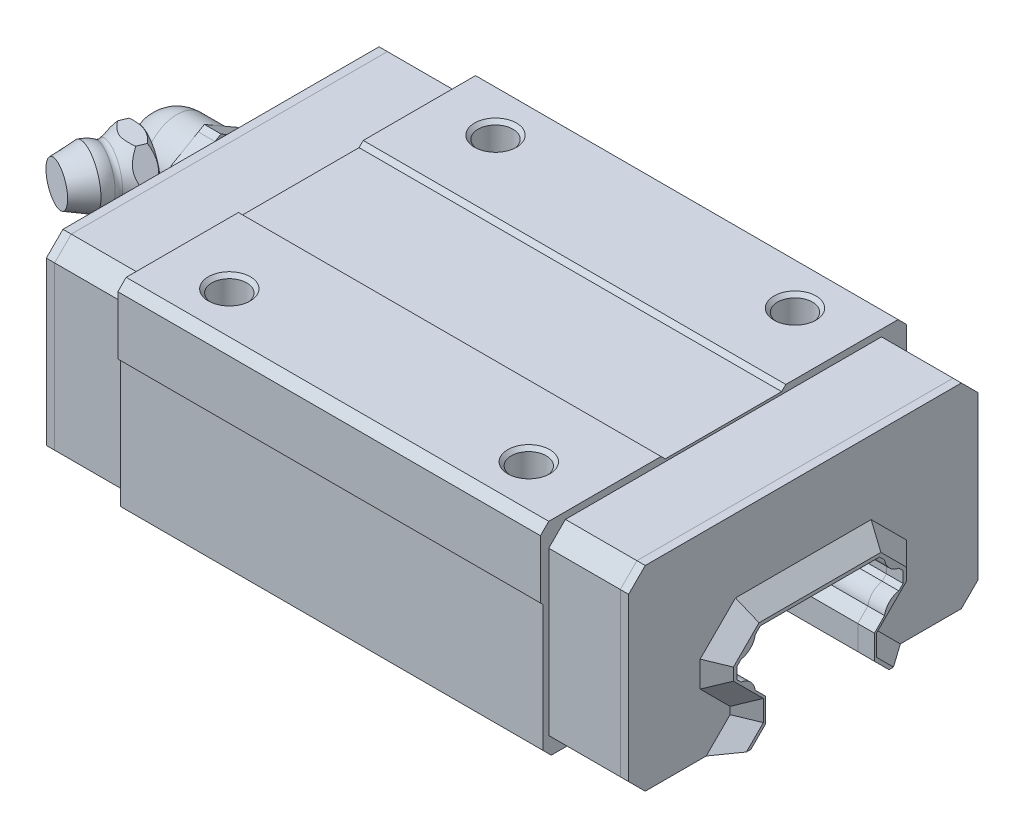
from build123d import *

# Parameters (mm, degrees)
BOSS_EXTRUDE1_START            = -69.999299
BOSS_EXTRUDE1_DEPTH            = 67.999756
BOSS_EXTRUDE4_START            = -78.599153
BOSS_EXTRUDE4_DEPTH            = 50.800048
BOSS_EXTRUDE5_DEPTH            = 1
BOSS_EXTRUDE6_DEPTH            = 1
M5X0_8_TAPPED_HOLE1_AT_2_COUNT = 2
M5X0_8_TAPPED_HOLE1_AT_2_PITCH = 48.16601337
M5X0_8_TAPPED_HOLE1_AT_3_COUNT = 2
M5X0_8_TAPPED_HOLE1_AT_3_PITCH = 32
M5X0_8_TAPPED_HOLE1_AT_4_COUNT = 2
M5X0_8_TAPPED_HOLE1_AT_4_PITCH = 35.999511719
CUT_EXTRUDE2_START             = -51.889852
SKETCH17_W                     = 9.974639027
SKETCH17_H                     = 9.95812392
CUT_EXTRUDE2_DEPTH             = 65.208591
BOSS_EXTRUDE7_DEPTH            = 1.999985
BOSS_EXTRUDE11_DEPTH           = 69.999755859
BOSS_EXTRUDE14_DEPTH           = 2
CHAMFER1_SIZE                  = 2
BOSS_EXTRUDE15_DEPTH           = 2
CHAMFER2_SIZE                  = 2


with BuildPart() as part:
    # Sketch8 → Boss-Extrude1 (new body)
    with BuildSketch(Plane.ZY.offset(-46.000945091).offset(BOSS_EXTRUDE1_START)):
        Polygon((-37.200896263, 28.981330872), (-37.200896263, 28.118293762), (-34.33245945, 25.249885559), (-30.000945091, 25.249656004), (-30.000945091, 25.249885559), (-27.000548363, 25.249566555), (-25.000540733, 27.249564648), (-25.000945091, 46.749885559), (-27.00083828, 48.749885559), (-45.275603294, 48.749885559), (-65.001051903, 48.749885559), (-67.000945091, 46.749992371), (-67.000494957, 27.249640942), (-65.000533104, 25.249685764), (-62.000945091, 25.249741775), (-61.132849693, 25.249705791), (-59.400938988, 25.249790324), (-57.668852297, 25.249822667), (-54.800749779, 28.118293762), (-54.800749779, 28.981330872), (-58.400847435, 32.581428528), (-58.400847435, 35.7032547), (-54.154265404, 39.949836731), (-37.847380638, 39.949836731), (-33.600509644, 35.702905655), (-33.600798607, 32.581428528), align=None)
    extrude(amount=-BOSS_EXTRUDE1_DEPTH)

    # Sketch9 → Boss-Extrude4 (add)
    with BuildSketch(Plane.ZY.offset(-46.000945091).offset(BOSS_EXTRUDE4_START)):
        Polygon((-67.700896263, 26.052594185), (-66.69870472, 25.050402641), (-62.000945091, 25.049934387), (-62.000945091, 25.249885559), (-62.000945091, 44.663492239), (-30.000945091, 44.663492239), (-30.000945091, 25.049934387), (-25.299723625, 25.049934387), (-24.300749779, 26.04890871), (-24.300749779, 41.249034882), (-24.000945091, 41.548839569), (-24.000945091, 48.550754557), (-25.000117299, 49.549934387), (-38.499411581, 49.549934387), (-38.999409674, 49.049934387), (-45.795134544, 49.049934387), (-46.20748806, 49.049934387), (-52.998428822, 49.049934387), (-53.498428345, 49.549934387), (-53.500700951, 49.549934387), (-67.000945091, 49.549934387), (-68.000945091, 48.549690247), (-68.000945091, 41.549934387), (-67.698792458, 41.250728607), align=None)
    extrude(amount=-BOSS_EXTRUDE4_DEPTH)

    # Sketch13 → M5x0.8 Tapped Hole1 (revolve, cut)
    with BuildSketch(Plane(origin=(132.000244141, 49.549934387, -30.000945091), x_dir=(0, 0, 1), z_dir=(1, 0, 0))):
        Polygon((0, 0), (0, 9.503075458), (2.1, 8.241268158), (2.1, 0.425), (2.525, 0), align=None)
    m5x0_8_tapped_hole1 = revolve(axis=Axis((132.000244141, 55.899934387, -30.000945091), (0, -1, 0)), mode=Mode.SUBTRACT)

    # M5x0.8 Tapped Hole1 at 2: M5x0.8 Tapped Hole1 ×2
    with Locations(*[Vector(0.7474048441996252, 0, -0.664368872590321) * (i * M5X0_8_TAPPED_HOLE1_AT_2_PITCH) for i in range(1, M5X0_8_TAPPED_HOLE1_AT_2_COUNT)]):
        add(m5x0_8_tapped_hole1, mode=Mode.SUBTRACT)

    # M5x0.8 Tapped Hole1 at 3: M5x0.8 Tapped Hole1 ×2
    with Locations(*[(0, 0, -i * M5X0_8_TAPPED_HOLE1_AT_3_PITCH) for i in range(1, M5X0_8_TAPPED_HOLE1_AT_3_COUNT)]):
        add(m5x0_8_tapped_hole1, mode=Mode.SUBTRACT)

    # M5x0.8 Tapped Hole1 at 4: M5x0.8 Tapped Hole1 ×2
    with Locations(*[(i * M5X0_8_TAPPED_HOLE1_AT_4_PITCH, 0, 0) for i in range(1, M5X0_8_TAPPED_HOLE1_AT_4_COUNT)]):
        add(m5x0_8_tapped_hole1, mode=Mode.SUBTRACT)


with BuildPart() as body_2:
    # Sketch11 → Boss-Extrude5 (new body)
    with BuildSketch(Plane(origin=(184, 0, 0), x_dir=(0, 0, -1), z_dir=(1, 0, 0))):
        Polygon((37.847380638, 39.949836731), (54.154265404, 39.949836731), (58.400847435, 35.7032547), (58.400847435, 32.581428528), (54.800749779, 28.981330872), (54.800749779, 28.118293762), (57.668852297, 25.249822667), (59.400938988, 25.249790324), (61.132849693, 25.249705791), (62.000945091, 25.249741775), (65.000533104, 25.249685764), (67.000494957, 27.249640942), (67.000945091, 46.749992371), (65.001051903, 48.749885559), (27.00083828, 48.749885559), (25.000945091, 46.749885559), (25.000540733, 27.249564648), (27.000548363, 25.249566555), (30.000945091, 25.249885559), (34.33245945, 25.249885559), (37.200896263, 28.118293762), (37.200896263, 28.981330872), (33.600798607, 32.581428528), (33.600509644, 35.702905655), align=None)
    extrude(amount=BOSS_EXTRUDE5_DEPTH)


with BuildPart() as body_3:
    # Sketch12 → Boss-Extrude6 (new body)
    with BuildSketch(Plane.ZY.offset(-116.000244141)):
        Polygon((-54.154265404, 39.949836731), (-37.847380638, 39.949836731), (-33.600509644, 35.702905655), (-33.600798607, 32.581428528), (-37.200896263, 28.981330872), (-37.200896263, 28.118293762), (-34.33245945, 25.249885559), (-30.000945091, 25.249656004), (-27.000548363, 25.249566555), (-25.000540733, 27.249564648), (-25.000945091, 46.749885559), (-27.00083828, 48.749885559), (-65.001051903, 48.749885559), (-67.000945091, 46.749992371), (-67.000494957, 27.249640942), (-65.000533104, 25.249685764), (-62.000945091, 25.249741775), (-61.132849693, 25.249705791), (-59.400938988, 25.249790324), (-57.668852297, 25.249822667), (-54.800749779, 28.118293762), (-54.800749779, 28.981330872), (-58.400847435, 32.581428528), (-58.400847435, 35.7032547), align=None)
    extrude(amount=BOSS_EXTRUDE6_DEPTH)

    # Sketch18 → Boss-Extrude7 (add)
    with BuildSketch(Plane.ZY.offset(-115.000244141)):
        Polygon((-46.726546205, 48.749885559), (-50.000945091, 46.85974884), (-50.000945091, 42.240533273), (-48.631224043, 41.449582905), (-46.033496656, 39.949836731), (-45.968542088, 39.949836731), (-42.000945091, 42.240119934), (-42.000587097, 46.859128776), (-45.27488782, 48.749885559), (-45.275568994, 48.749885559), align=None)
        Polygon((-46.000992693, 49.1687091), (-46.726546205, 48.749885559), (-45.275568994, 48.749885559), align=None)
    extrude(amount=BOSS_EXTRUDE7_DEPTH)



with BuildPart() as body_4:
    # Sketch16 → Revolve1 (revolve)
    with BuildSketch(Plane(origin=(0, 44.549934387, 0), x_dir=(-1, 0, 0), z_dir=(0, 1, 0)), mode=Mode.PRIVATE) as revolve1_sk:
        with BuildLine():
            Line((-105.617607117, -44.363028526), (-108.80043245, -43.044703315))
            Line((-108.80043245, -43.044703315), (-105.700494728, -35.560886301))
            Line((-105.700494728, -35.560886301), (-103.483024597, -36.479392052))
            Line((-103.483024597, -36.479392052), (-103.684791565, -39.318274498))
            ThreePointArc((-103.684791565, -39.318274498), (-104.045671043, -39.969854034), (-104.543486379, -40.523902571))
            ThreePointArc((-104.543486379, -40.523902571), (-104.748995386, -40.809827783), (-104.811833864, -41.156293516))
            ThreePointArc((-104.811833864, -41.156293516), (-104.693571108, -42.113365948), (-104.42350769, -43.039130211))
            Line((-104.42350769, -43.039130211), (-104.838172913, -44.040205956))
            Line((-104.838172913, -44.040205956), (-105.617607117, -44.363028526))
        make_face()
    revolve(revolve1_sk.sketch.rotate(Axis((105.001716614, 44.549934387, -33.873908043), (0.38268756468709164, 0, -0.9238778208366424)), 180), axis=Axis((105.001716614, 44.549934387, -33.873908043), (0.38268756468709164, 0, -0.9238778208366424)))

    # Sketch17 → Cut-Extrude2 (cut)
    with BuildSketch(Plane(origin=(30.924229963, 0, -74.656750899), x_dir=(0.9238778208366417, 0, 0.38268756468709325), z_dir=(-0.38268756468709325, 0, 0.9238778208366417)).offset(CUT_EXTRUDE2_START)):
        with Locations((84.045633753, 44.549934387)):
            Rectangle(SKETCH17_W, SKETCH17_H)
        Polygon((82.024828278, 48.050072143), (80.004022803, 44.549934387), (82.024828278, 41.049796631), (86.06643923, 41.049796631), (88.087244705, 44.549934387), (86.06643923, 48.050072143), align=None, mode=Mode.SUBTRACT)
    extrude(amount=CUT_EXTRUDE2_DEPTH, mode=Mode.SUBTRACT)


with BuildPart() as body_3_1:
    add(body_3.part)

    add(body_4.part)  # Revolve3 merges body 4
    # Sketch19 → Revolve3 (revolve)
    with BuildSketch(Plane(origin=(0, 44.549934387, 0), x_dir=(-1, 0, 0), z_dir=(0, 1, 0))):
        with BuildLine():
            Line((-109.7003479, -50.000945091), (-113.000259399, -50.000945091))
            Line((-113.000259399, -50.000945091), (-113.000259399, -46.000945091))
            Line((-113.000259399, -46.000945091), (-105.7003479, -46.000945091))
            ThreePointArc((-105.7003479, -46.000945091), (-106.871920776, -48.829372216), (-109.7003479, -50.000945091))
        make_face()
    revolve(axis=Axis((105.7003479, 44.549934387, -46.000945091), (1, 0, 0)))


with BuildPart() as body_4_2:
    # Sketch20 → Boss-Extrude11 (new body)
    with BuildSketch(Plane.ZY.offset(-115.000244141)):
        with BuildLine():
            Line((-56.000945091, 34.709846497), (-55.473011971, 35.236911774))
            ThreePointArc((-55.473011971, 35.236911774), (-54.345303642, 35.813840972), (-53.768374443, 36.941549301))
            Line((-53.768374443, 36.941549301), (-53.160857201, 37.549934387))
            Line((-53.160857201, 37.549934387), (-38.840519428, 37.549545288))
            Line((-38.840519428, 37.549545288), (-38.232676506, 36.941701889))
            ThreePointArc((-38.232676506, 36.941701889), (-37.655754627, 35.814040922), (-36.528093338, 35.237119675))
            Line((-36.528093338, 35.237119675), (-36.000945091, 34.709846497))
            Line((-36.000945091, 34.709846497), (-36.000945091, 33.379768372))
            Line((-36.000945091, 33.379768372), (-36.516084671, 32.863981247))
            ThreePointArc((-36.516084671, 32.863981247), (-37.65565644, 32.285168434), (-38.234468937, 31.145596504))
            Line((-38.234468937, 31.145596504), (-39.450896263, 29.9298172))
            Line((-39.450896263, 29.9298172), (-39.450896263, 26.999885559))
            Line((-39.450896263, 26.999885559), (-37.700857082, 25.249885559))
            Line((-37.700857082, 25.249885559), (-34.33245945, 25.249885559))
            Line((-34.33245945, 25.249885559), (-37.200896263, 28.118293762))
            Line((-37.200896263, 28.118293762), (-37.200896263, 28.981330872))
            Line((-37.200896263, 28.981330872), (-33.600798607, 32.581428528))
            Line((-33.600798607, 32.581428528), (-33.600509644, 35.702905655))
            Line((-33.600509644, 35.702905655), (-37.847380638, 39.949836731))
            Line((-37.847380638, 39.949836731), (-45.968542088, 39.949836731))
            Line((-45.968542088, 39.949836731), (-46.033496656, 39.949836731))
            Line((-46.033496656, 39.949836731), (-54.154265404, 39.949836731))
            Line((-54.154265404, 39.949836731), (-58.400847435, 35.7032547))
            Line((-58.400847435, 35.7032547), (-58.400847435, 32.581428528))
            Line((-58.400847435, 32.581428528), (-54.800749779, 28.981330872))
            Line((-54.800749779, 28.981330872), (-54.800749779, 28.118293762))
            Line((-54.800749779, 28.118293762), (-57.668852297, 25.249822667))
            Line((-57.668852297, 25.249822667), (-54.300749779, 25.249885559))
            Line((-54.300749779, 25.249885559), (-52.550749779, 26.999885559))
            Line((-52.550749779, 26.999885559), (-52.550749779, 29.9298172))
            Line((-52.550749779, 29.9298172), (-53.766649723, 31.145683289))
            ThreePointArc((-53.766649723, 31.145683289), (-54.345460672, 32.285243093), (-55.485020638, 32.864053726))
            Line((-55.485020638, 32.864053726), (-56.000945091, 33.379768372))
            Line((-56.000945091, 33.379768372), (-56.000945091, 34.709846497))
        make_face()
    extrude(amount=-BOSS_EXTRUDE11_DEPTH)


with BuildPart() as body_5:
    # Sketch21 → Boss-Extrude14 (new body)
    with BuildSketch(Plane.ZY.offset(-115.000244141)):
        with BuildLine():
            Line((-56.000945091, 34.709846497), (-55.473011971, 35.236911774))
            ThreePointArc((-55.473011971, 35.236911774), (-54.345303642, 35.813840972), (-53.768374443, 36.941549301))
            Line((-53.768374443, 36.941549301), (-53.160857201, 37.549934387))
            Line((-53.160857201, 37.549934387), (-38.840519428, 37.549545288))
            Line((-38.840519428, 37.549545288), (-38.232676506, 36.941701889))
            ThreePointArc((-38.232676506, 36.941701889), (-37.655754627, 35.814040922), (-36.528093338, 35.237119675))
            Line((-36.528093338, 35.237119675), (-36.000945091, 34.709846497))
            Line((-36.000945091, 34.709846497), (-36.000945091, 33.379768372))
            Line((-36.000945091, 33.379768372), (-36.516084671, 32.863981247))
            ThreePointArc((-36.516084671, 32.863981247), (-37.65565644, 32.285168434), (-38.234468937, 31.145596504))
            Line((-38.234468937, 31.145596504), (-39.450896263, 29.9298172))
            Line((-39.450896263, 29.9298172), (-39.450896263, 26.999885559))
            Line((-39.450896263, 26.999885559), (-37.700857082, 25.249885559))
            Line((-37.700857082, 25.249885559), (-34.33245945, 25.249885559))
            Line((-34.33245945, 25.249885559), (-37.200896263, 28.118293762))
            Line((-37.200896263, 28.118293762), (-37.200896263, 28.981330872))
            Line((-37.200896263, 28.981330872), (-33.600798607, 32.581428528))
            Line((-33.600798607, 32.581428528), (-33.600509644, 35.702905655))
            Line((-33.600509644, 35.702905655), (-37.847380638, 39.949836731))
            Line((-37.847380638, 39.949836731), (-54.154265404, 39.949836731))
            Line((-54.154265404, 39.949836731), (-58.400847435, 35.7032547))
            Line((-58.400847435, 35.7032547), (-58.400847435, 32.581428528))
            Line((-58.400847435, 32.581428528), (-54.800749779, 28.981330872))
            Line((-54.800749779, 28.981330872), (-54.800749779, 28.118293762))
            Line((-54.800749779, 28.118293762), (-57.668852297, 25.249822667))
            Line((-57.668852297, 25.249822667), (-54.300749779, 25.249885559))
            Line((-54.300749779, 25.249885559), (-52.550749779, 26.999885559))
            Line((-52.550749779, 26.999885559), (-52.550749779, 29.9298172))
            Line((-52.550749779, 29.9298172), (-53.766649723, 31.145683289))
            ThreePointArc((-53.766649723, 31.145683289), (-54.345460672, 32.285243093), (-55.485020638, 32.864053726))
            Line((-55.485020638, 32.864053726), (-56.000945091, 33.379768372))
            Line((-56.000945091, 33.379768372), (-56.000945091, 34.709846497))
        make_face()
    extrude(amount=BOSS_EXTRUDE14_DEPTH)

    # Chamfer1
    chamfer1_edges = [body_5.edges().sort_by_distance(p)[0] for p in [
        (113.000244141, 26.684089661, -35.766677856),
        (113.000244141, 28.549812317, -37.200896263),
        (113.000244141, 30.7813797, -35.400847435),
        (113.000244141, 34.142167091, -33.600654125),
        (113.000244141, 37.826371193, -35.723945141),
        (113.000244141, 39.949836731, -46.000823021),
        (113.000244141, 37.826545715, -56.277556419),
        (113.000244141, 34.142341614, -58.400847435),
        (113.000244141, 30.7813797, -56.600798607),
        (113.000244141, 28.549812317, -54.800749779),
        (113.000244141, 26.684058215, -56.234801038),
    ]]
    chamfer(chamfer1_edges, length=CHAMFER1_SIZE - 0.0001)  # a hair under: the kernel refuses the full size


with BuildPart() as body_6:
    # Sketch22 → Boss-Extrude15 (new body)
    with BuildSketch(Plane(origin=(185, 0, 0), x_dir=(0, 0, -1), z_dir=(1, 0, 0))):
        with BuildLine():
            Line((55.473011971, 35.236911774), (56.000945091, 34.709846497))
            Line((56.000945091, 34.709846497), (56.000945091, 33.379768372))
            Line((56.000945091, 33.379768372), (55.485020638, 32.864053726))
            ThreePointArc((55.485020638, 32.864053726), (54.345460672, 32.285243093), (53.766649723, 31.145683289))
            Line((53.766649723, 31.145683289), (52.550749779, 29.9298172))
            Line((52.550749779, 29.9298172), (52.550749779, 26.999885559))
            Line((52.550749779, 26.999885559), (54.300749779, 25.249885559))
            Line((54.300749779, 25.249885559), (57.668852297, 25.249822667))
            Line((57.668852297, 25.249822667), (54.800749779, 28.118293762))
            Line((54.800749779, 28.118293762), (54.800749779, 28.981330872))
            Line((54.800749779, 28.981330872), (58.400847435, 32.581428528))
            Line((58.400847435, 32.581428528), (58.400847435, 35.7032547))
            Line((58.400847435, 35.7032547), (54.154265404, 39.949836731))
            Line((54.154265404, 39.949836731), (37.847380638, 39.949836731))
            Line((37.847380638, 39.949836731), (33.600509644, 35.702905655))
            Line((33.600509644, 35.702905655), (33.600798607, 32.581428528))
            Line((33.600798607, 32.581428528), (37.200896263, 28.981330872))
            Line((37.200896263, 28.981330872), (37.200896263, 28.118293762))
            Line((37.200896263, 28.118293762), (34.33245945, 25.249885559))
            Line((34.33245945, 25.249885559), (37.700857082, 25.249885559))
            Line((37.700857082, 25.249885559), (39.450896263, 26.999885559))
            Line((39.450896263, 26.999885559), (39.450896263, 29.9298172))
            Line((39.450896263, 29.9298172), (38.234468937, 31.145596504))
            ThreePointArc((38.234468937, 31.145596504), (37.65565644, 32.285168434), (36.516084671, 32.863981247))
            Line((36.516084671, 32.863981247), (36.000945091, 33.379768372))
            Line((36.000945091, 33.379768372), (36.000945091, 34.709846497))
            Line((36.000945091, 34.709846497), (36.528093338, 35.237119675))
            ThreePointArc((36.528093338, 35.237119675), (37.655754627, 35.814040922), (38.232676506, 36.941701889))
            Line((38.232676506, 36.941701889), (38.840519428, 37.549545288))
            Line((38.840519428, 37.549545288), (53.160857201, 37.549934387))
            Line((53.160857201, 37.549934387), (53.768374443, 36.941549301))
            ThreePointArc((53.768374443, 36.941549301), (54.345303642, 35.813840972), (55.473011971, 35.236911774))
        make_face()
    extrude(amount=BOSS_EXTRUDE15_DEPTH)

    # Chamfer2
    chamfer2_edges = [body_6.edges().sort_by_distance(p)[0] for p in [
        (187, 26.684058215, -56.234801038),
        (187, 28.549812317, -54.800749779),
        (187, 30.7813797, -56.600798607),
        (187, 34.142341614, -58.400847435),
        (187, 37.826545715, -56.277556419),
        (187, 39.949836731, -46.000823021),
        (187, 37.826371193, -35.723945141),
        (187, 34.142167091, -33.600654125),
        (187, 30.7813797, -35.400847435),
        (187, 28.549812317, -37.200896263),
        (187, 26.684089661, -35.766677856),
    ]]
    chamfer(chamfer2_edges, length=CHAMFER2_SIZE - 0.0001)  # a hair under: the kernel refuses the full size


solid = Compound([part.part, body_2.part, body_3_1.part, body_4_2.part, body_5.part, body_6.part])
